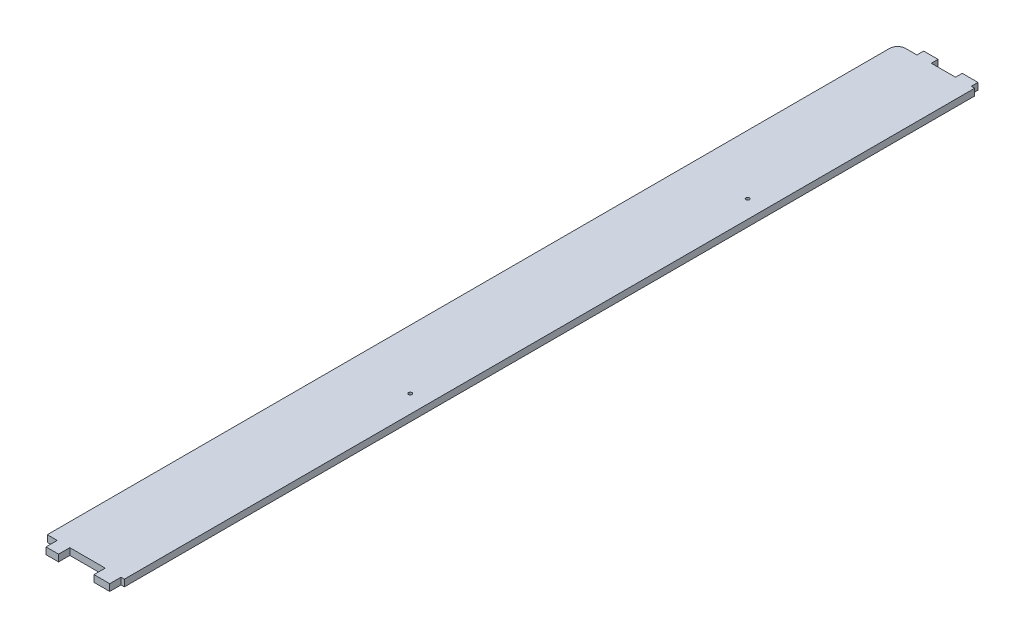
from build123d import *

# Parameters (mm, degrees)
DODANIE_WYCI_GNI_CIE1_DEPTH      = 766
DODANIE_WYCI_GNI_CIE1_DEPTH_BACK = 10
OBIEKT_PRZENIE_KOPIUJ1_ANGLE     = 10
SZKIC2_W                         = 31.5
SZKIC2_H                         = 10
SZKIC2_W_2                       = 8
SZKIC2_H_2                       = 4
SZKIC2_W_3                       = 3
WYTNIJ_WYCI_GNI_CIE1_DEPTH       = 6
SZKIC3_R                         = 1.55
WYTNIJ_WYCI_GNI_CIE2_DEPTH       = 6
SZYK_LINIOWY1_COUNT              = 2
SZYK_LINIOWY1_PITCH              = 300
WYTNIJ_WYCI_GNI_CIE3_DEPTH       = 6
SZKIC5_W                         = 12
SZKIC5_H                         = 6
DODANIE_WYCI_GNI_CIE2_DEPTH      = 6
SZKIC14_W                        = 8.832436052
SZKIC14_H                        = 6
WYTNIJ_WYCI_GNI_CIE6_DEPTH       = 10


with BuildPart() as part:
    # Szkic1 → Dodanie-wyciągnięcie1 (new, two sides: drawn at the far end of the back side and taken through both)
    with BuildSketch(Plane.XY.offset(-DODANIE_WYCI_GNI_CIE1_DEPTH_BACK)):
        Polygon((-272.410348111, -398.072591802), (-271.368459045, -403.98143832), (-338.827790127, -415.87633849), (-339.869679193, -409.967491972), align=None)
    extrude(amount=DODANIE_WYCI_GNI_CIE1_DEPTH + DODANIE_WYCI_GNI_CIE1_DEPTH_BACK)


with BuildPart() as part_1:
    # Obiekt-Przenieś/Kopiuj1: read off the stored shape, not the designer's step
    # Obiekt-Przenieś/Kopiuj1: moved
    add(part.part.moved(Location((4.1385253, 350.7690313, 0))).rotate(Axis((0, 0, 0), (0, 0, -1)), OBIEKT_PRZENIE_KOPIUJ1_ANGLE))

    # Szkic2 → Wytnij-wyciągnięcie1 (cut)
    with BuildSketch(Plane(origin=(0, 0, 0), x_dir=(1, 0, 0), z_dir=(0, 1, 0))):
        with Locations((-305.160348111, -761)):
            Rectangle(SZKIC2_W, SZKIC2_H)
        with Locations((-336.910348111, -768)):
            Rectangle(SZKIC2_W_2, SZKIC2_H_2)
        with Locations((-273.910348111, -761)):
            Rectangle(SZKIC2_W_3, SZKIC2_H)
    wytnij_wyci_gni_cie1 = extrude(amount=-WYTNIJ_WYCI_GNI_CIE1_DEPTH, mode=Mode.SUBTRACT)

    # Szkic3 → Wytnij-wyciągnięcie2 (cut)
    with BuildSketch(Plane(origin=(0, 0, 0), x_dir=(1, 0, 0), z_dir=(0, 1, 0))):
        with Locations(Location((-288.210889387, -486, 0), (0, 0, 180))):
            Circle(SZKIC3_R)
    wytnij_wyci_gni_cie2 = extrude(amount=-WYTNIJ_WYCI_GNI_CIE2_DEPTH, mode=Mode.SUBTRACT)

    # Szyk liniowy1: Wytnij-wyciągnięcie2 ×2
    with Locations(*[(0, 0, -i * SZYK_LINIOWY1_PITCH) for i in range(1, SZYK_LINIOWY1_COUNT)]):
        add(wytnij_wyci_gni_cie2, mode=Mode.SUBTRACT)

    # Lustro1: Wytnij-wyciągnięcie1 across plane
    add(wytnij_wyci_gni_cie1.mirror(Plane(origin=(-569.794054039, 7.161771209, 378), x_dir=(1, 0, 0), z_dir=(0, 0, 1))), mode=Mode.SUBTRACT)

    # Szkic4 → Wytnij-wyciągnięcie3 (cut)
    with BuildSketch(Plane(origin=(0, 0, 0), x_dir=(1, 0, 0), z_dir=(0, 1, 0))):
        with BuildLine():
            Line((-275.410348111, 10), (-340.910348111, 10))
            Line((-340.910348111, 10), (-340.910348111, -7.2))
            ThreePointArc((-340.910348111, -7.2), (-338.801516936, -2.108831175), (-333.710348111, 0))
            Line((-333.710348111, 0), (-323.696161673, 0))
            Line((-323.696161673, 0), (-323.696161673, 6))
            Line((-323.696161673, 6), (-275.410348111, 6))
            Line((-275.410348111, 6), (-275.410348111, 10))
        make_face()
    extrude(amount=-WYTNIJ_WYCI_GNI_CIE3_DEPTH, mode=Mode.SUBTRACT)

    # Szkic5 → Dodanie-wyciągnięcie2 (add)
    with BuildSketch(Plane(origin=(0, 0, 0), x_dir=(1, 0, 0), z_dir=(0, 1, 0))):
        with Locations((-316.910348111, 3)):
            Rectangle(SZKIC5_W, SZKIC5_H)
    extrude(amount=-DODANIE_WYCI_GNI_CIE2_DEPTH)

    # Szkic14 → Wytnij-wyciągnięcie6 (cut)
    with BuildSketch(Plane.XY.offset(766)):
        with Locations((-336.494130085, -3)):
            Rectangle(SZKIC14_W, SZKIC14_H)
    extrude(amount=-WYTNIJ_WYCI_GNI_CIE6_DEPTH, mode=Mode.SUBTRACT)


solid = part_1.part
